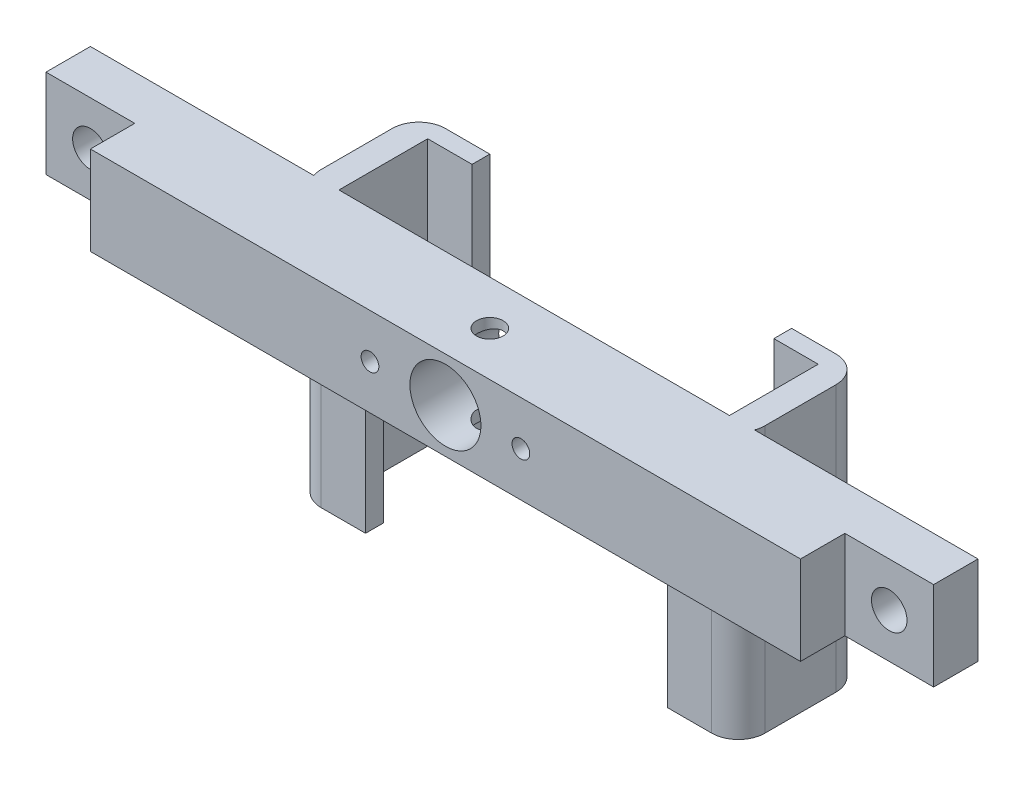
from build123d import *

# Parameters (mm, degrees)
SKETCH1_W           = 100
SKETCH1_H           = 10
BOSS_EXTRUDE1_DEPTH = 10
SKETCH6_W           = 3
SKETCH6_H           = 10
BOSS_EXTRUDE2_DEPTH = 12
SKETCH8_W           = 2
SKETCH8_H           = 10
BOSS_EXTRUDE3_DEPTH = 5
BOSS_EXTRUDE4_DEPTH = 20
SKETCH2_W           = 10
SKETCH2_H           = 5
CUT_EXTRUDE1_DEPTH  = 10
CUT_EXTRUDE2_REACH  = 60.429
SKETCH10_R          = 2
SKETCH13_R          = 4
SKETCH13_R_2        = 1
CUT_EXTRUDE3_DEPTH  = 58.175169436
FILLET1_R           = 3
FILLET2_R           = 3
SKETCH14_R          = 1.5
CUT_EXTRUDE4_DEPTH  = 10


with BuildPart() as part:
    # Sketch1 → Boss-Extrude1 (new body)
    with BuildSketch(Plane.XY):
        Rectangle(SKETCH1_W, SKETCH1_H)
    extrude(amount=BOSS_EXTRUDE1_DEPTH)

    # Sketch6 → Boss-Extrude2 (add)
    with BuildSketch(Plane(origin=(0, 0, 0), x_dir=(-1, 0, 0), z_dir=(0, 0, -1))):
        with Locations((-23.5, 0)):
            Rectangle(SKETCH6_W, SKETCH6_H)
    boss_extrude2 = extrude(amount=BOSS_EXTRUDE2_DEPTH)

    # Sketch8 → Boss-Extrude3 (add)
    with BuildSketch(Plane.ZY.offset(-22)):
        with Locations((-11, 0)):
            Rectangle(SKETCH8_W, SKETCH8_H)
    boss_extrude3 = extrude(amount=BOSS_EXTRUDE3_DEPTH)

    # Sketch9 → Boss-Extrude4 (add)
    with BuildSketch(Plane.XZ.offset(5)):
        Polygon((17, 2), (17, 0), (22, 0), (22, -10), (17, -10), (17, -12), (25, -12), (25, 0), (25, 2), align=None)
    boss_extrude4 = extrude(amount=BOSS_EXTRUDE4_DEPTH)

    # Mirror3: Boss-Extrude2, Boss-Extrude3, Boss-Extrude4 across plane
    add(boss_extrude2.mirror(Plane(origin=(0, 0, 0), x_dir=(0, 0, 1), z_dir=(1, 0, 0))))
    add(boss_extrude3.mirror(Plane(origin=(0, 0, 0), x_dir=(0, 0, 1), z_dir=(1, 0, 0))))
    add(boss_extrude4.mirror(Plane(origin=(0, 0, 0), x_dir=(0, 0, 1), z_dir=(1, 0, 0))))

    # Sketch2 → Cut-Extrude1 (cut)
    with BuildSketch(Plane(origin=(0, 5, 0), x_dir=(1, 0, 0), z_dir=(0, 1, 0))):
        with Locations((-45, -7.5)):
            Rectangle(SKETCH2_W, SKETCH2_H)
    cut_extrude1 = extrude(amount=-CUT_EXTRUDE1_DEPTH, mode=Mode.SUBTRACT)

    # Mirror4: Cut-Extrude1 across plane
    add(cut_extrude1.mirror(Plane(origin=(0, 0, 0), x_dir=(0, 0, 1), z_dir=(1, 0, 0))), mode=Mode.SUBTRACT)

    # Sketch10 → Cut-Extrude2 (cut, up to next)
    with BuildSketch(Plane.XY.offset(5), mode=Mode.PRIVATE) as cut_extrude2_sk1:
        with Locations((45, 0)):
            Circle(SKETCH10_R)
    cut_extrude2_tool1 = extrude(cut_extrude2_sk1.sketch, amount=-CUT_EXTRUDE2_REACH, mode=Mode.PRIVATE) & part.part
    cut_extrude2 = cut_extrude2_tool1.solids().sort_by_distance((45, 0, 5))[0]
    add(cut_extrude2, mode=Mode.SUBTRACT)

    # Mirror5: Cut-Extrude2 across plane
    add(cut_extrude2.mirror(Plane(origin=(0, 0, 0), x_dir=(0, 0, 1), z_dir=(1, 0, 0))), mode=Mode.SUBTRACT)

    # Sketch13 → Cut-Extrude3 (cut, through all)
    with BuildSketch(Plane(origin=(0, 0, 0), x_dir=(-1, 0, 0), z_dir=(0, 0, -1))):
        Circle(SKETCH13_R)
        with Locations((-8.5, 0)):
            Circle(SKETCH13_R_2)
        with Locations((8.5, 0)):
            Circle(SKETCH13_R_2)
    extrude(amount=-CUT_EXTRUDE3_DEPTH, mode=Mode.SUBTRACT)

    # Fillet1
    fillet1_edges = [part.edges().sort_by_distance(p)[0] for p in [
        (25, -10, -12),
        (-25, -10, -12),
    ]]
    fillet(fillet1_edges, radius=FILLET1_R)

    # Fillet2
    fillet2_edges = [part.edges().sort_by_distance(p)[0] for p in [
        (-25, -15, 2),
        (25, -15, 2),
    ]]
    fillet(fillet2_edges, radius=FILLET2_R)

    # Sketch14 → Cut-Extrude4 (cut)
    with BuildSketch(Plane(origin=(0, 5, 0), x_dir=(1, 0, 0), z_dir=(0, 1, 0))):
        with Locations((0, -5)):
            Circle(SKETCH14_R)
    extrude(amount=-CUT_EXTRUDE4_DEPTH, mode=Mode.SUBTRACT)


solid = part.part
